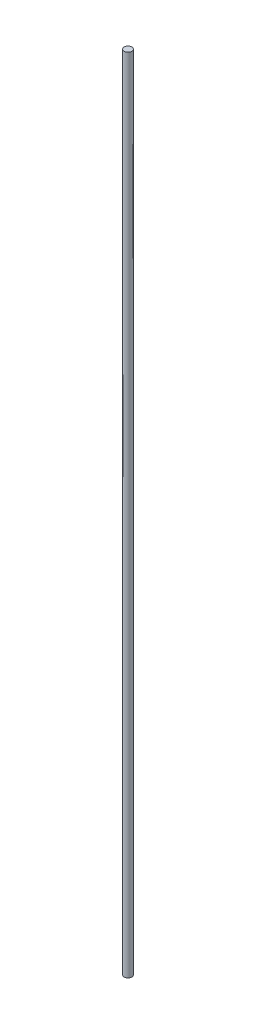
from build123d import *

# Parameters (mm, degrees)
SKETCH1_R           = 0.825
BOSS_EXTRUDE1_DEPTH = 173


with BuildPart() as part:
    # Sketch1 → Boss-Extrude1 (new body)
    with BuildSketch(Plane(origin=(0, 0, 0), x_dir=(1, 0, 0), z_dir=(0, 1, 0))):
        Circle(SKETCH1_R)
    extrude(amount=BOSS_EXTRUDE1_DEPTH)


solid = part.part
